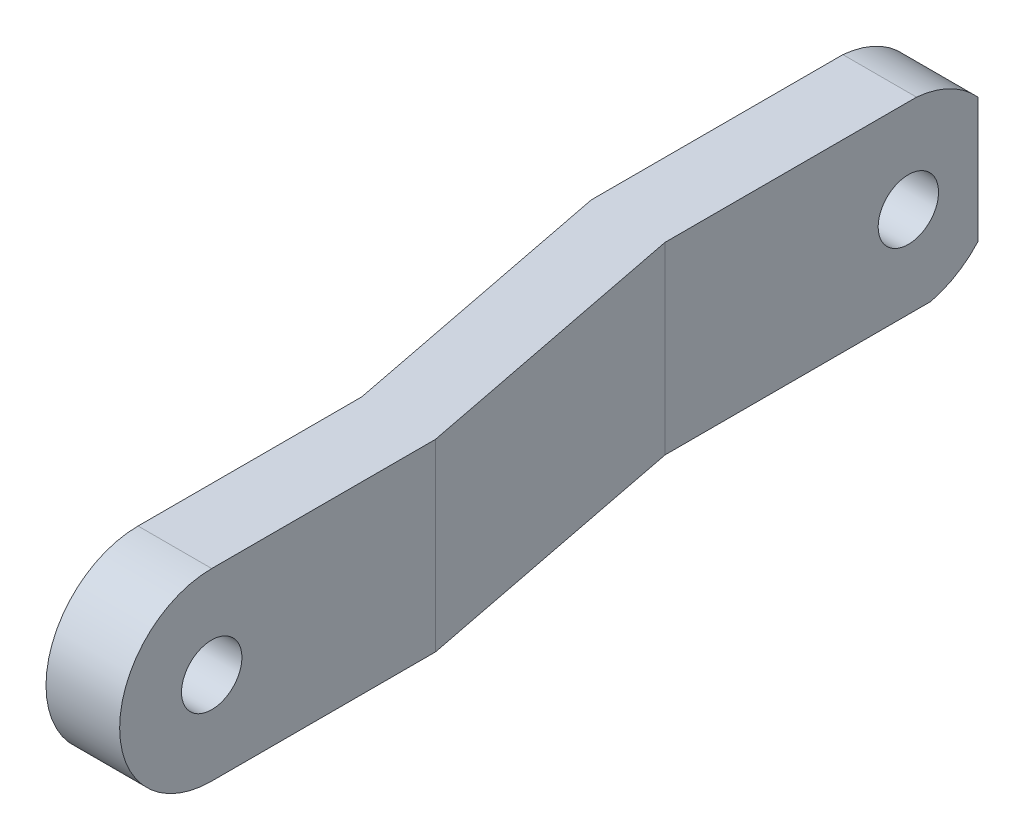
from build123d import *

# Parameters (mm, degrees)
BOSS_EXTRUDE1_DEPTH     = 6.35
CUT_EXTRUDE1_DEPTH      = 30.397829873
CUT_EXTRUDE1_DEPTH_BACK = 3.556
CUT_EXTRUDE2_DEPTH      = 30.167570917
CUT_EXTRUDE2_DEPTH_BACK = 3.556
SKETCH4_3_R             = 1.0414
CUT_EXTRUDE3_DEPTH      = 2.54
SKETCH3_3_R             = 1.0414
CUT_EXTRUDE4_DEPTH      = 2.54


with BuildPart() as part:
    # Sketch1 → Boss-Extrude1 (new body)
    with BuildSketch(Plane(origin=(0, 0, 0), x_dir=(1, 0, 0), z_dir=(0, 1, 0))):
        Polygon((-24.015298923, -26.283339213), (-24.015298923, -25.179419289), (-24.015298923, -17.460268456), (-25.940364211, -7.62), (-25.940364211, 3.175), (-23.400364211, 3.175), (-23.400364211, -7.62), (-21.475298923, -17.460268456), (-21.475298923, -25.179419289), (-21.475298923, -28.354419289), (-24.015298923, -28.354419289), align=None)
    extrude(amount=BOSS_EXTRUDE1_DEPTH)

    # Sketch3 → Cut-Extrude1 (cut, two sides: drawn at the far end of the back side and taken through both)
    with BuildSketch(Plane.ZY.offset(25.940364211).offset(-CUT_EXTRUDE1_DEPTH_BACK)):
        with BuildLine():
            ThreePointArc((-1.545706988, 0), (-2.433923844, 0.366279202), (-3.175, 0.977749372))
            Line((-3.175, 0.977749372), (-3.175, 0))
            Line((-3.175, 0), (-1.545706988, 0))
        make_face()
        with BuildLine():
            ThreePointArc((-3.175, 5.290727319), (-2.215741663, 6.021940938), (-1.055040511, 6.35))
            Line((-1.055040511, 6.35), (-3.175, 6.35))
            Line((-3.175, 6.35), (-3.175, 5.290727319))
        make_face()
    extrude(amount=CUT_EXTRUDE1_DEPTH + CUT_EXTRUDE1_DEPTH_BACK, mode=Mode.SUBTRACT)

    # Sketch4 → Cut-Extrude2 (cut, two sides: drawn at the far end of the back side and taken through both)
    with BuildSketch(Plane.ZY.offset(24.015298923).offset(-CUT_EXTRUDE2_DEPTH_BACK)):
        with BuildLine():
            Line((28.354419289, 6.35), (25.179419289, 6.35))
            ThreePointArc((25.179419289, 6.35), (27.424483319, 5.42006403), (28.354419289, 3.175))
            Line((28.354419289, 3.175), (28.354419289, 6.35))
        make_face()
        with BuildLine():
            Line((28.354419289, 0), (28.354419289, 3.175))
            ThreePointArc((28.354419289, 3.175), (27.424483319, 0.92993597), (25.179419289, 0))
            Line((25.179419289, 0), (28.354419289, 0))
        make_face()
    extrude(amount=CUT_EXTRUDE2_DEPTH + CUT_EXTRUDE2_DEPTH_BACK, mode=Mode.SUBTRACT)

    # Sketch4<3> → Cut-Extrude3 (cut)
    with BuildSketch(Plane.ZY.offset(24.015298923)):
        with Locations((25.179419289, 3.175)):
            Circle(SKETCH4_3_R)
    extrude(amount=-CUT_EXTRUDE3_DEPTH, mode=Mode.SUBTRACT)

    # Sketch3<3> → Cut-Extrude4 (cut)
    with BuildSketch(Plane.ZY.offset(25.940364211)):
        with Locations((-0.772853494, 3.134238346)):
            Circle(SKETCH3_3_R)
    extrude(amount=-CUT_EXTRUDE4_DEPTH, mode=Mode.SUBTRACT)


solid = part.part
